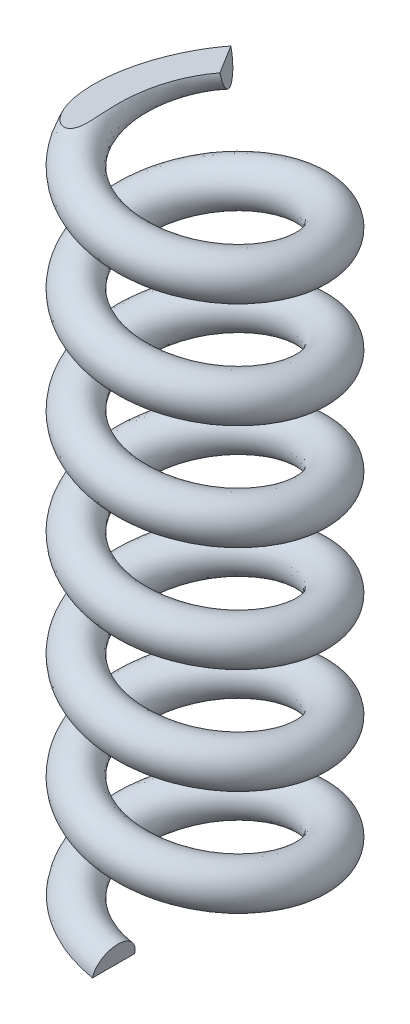
from build123d import *

# Parameters (mm, degrees)
SWEEP1_PITCH            = 5
SWEEP1_HEIGHT           = 32
SWEEP1_RADIUS           = 4
SKETCH2_R               = 1
CUT_EXTRUDE2_DEPTH      = 10
CUT_EXTRUDE4_DEPTH      = 34.796517239
CUT_EXTRUDE4_DEPTH_BACK = 34.796517239


with BuildPart() as part:
    # Sweep1: sweep along a helix
    with BuildLine() as sweep1_path:
        Helix(SWEEP1_PITCH, SWEEP1_HEIGHT, SWEEP1_RADIUS, center=(0, 0, 0), direction=(0, 1, 0), lefthand=True)
    # Sketch2 → Sweep1 (sweep)
    with BuildSketch(Plane(origin=(-2.351141009, 32, -3.236067977), x_dir=(-0.5598100430571367, -0.13766171811671904, -0.8171058481356746), z_dir=(0.793467205503731, 0.19511986277060567, -0.5764876693759201))):
        with Locations((0.325253556, 0.011586743)):
            Circle(SKETCH2_R)
    sweep(path=sweep1_path.line, is_frenet=True)

    # Sketch3 → Cut-Extrude2 (cut)
    with BuildSketch(Plane(origin=(4.954296933, 1.218330365, -3.599760176), x_dir=(-0.5598349963786573, -0.13767119430722935, -0.8170871551356869), z_dir=(0.793447955596402, 0.1951198627706057, -0.5765141636701305))):
        Polygon((-1.119950848, 31.648140289), (2.901528783, 31.648140289), (2.901528783, 34.009996388), (-1.119950848, 34.009996388), (-3.535186032, 34.009996388), (-5.014647692, 34.009996388), (-7.645277484, 34.009996388), (-7.645277484, 31.648140289), (-5.014647692, 31.648140289), (-3.535186032, 31.648140289), align=None)
    extrude(amount=-CUT_EXTRUDE2_DEPTH, mode=Mode.SUBTRACT)

    # Sketch5 → Cut-Extrude4 (cut, two sides: drawn at the far end of the back side and taken through both)
    with BuildSketch(Plane(origin=(0, 0, 0), x_dir=(0, 0, -1), z_dir=(0.9807794039193422, -0.1951198627706057, 0)).offset(-CUT_EXTRUDE4_DEPTH_BACK)):
        Polygon((-94.795127732, -0.034180389), (-10.720136808, -0.034180389), (6.65303106, -0.034180389), (90.728021984, -0.034180389), (90.728021984, -168.184162237), (-94.795127732, -168.184162237), align=None)
    extrude(amount=CUT_EXTRUDE4_DEPTH + CUT_EXTRUDE4_DEPTH_BACK, mode=Mode.SUBTRACT)


solid = part.part
